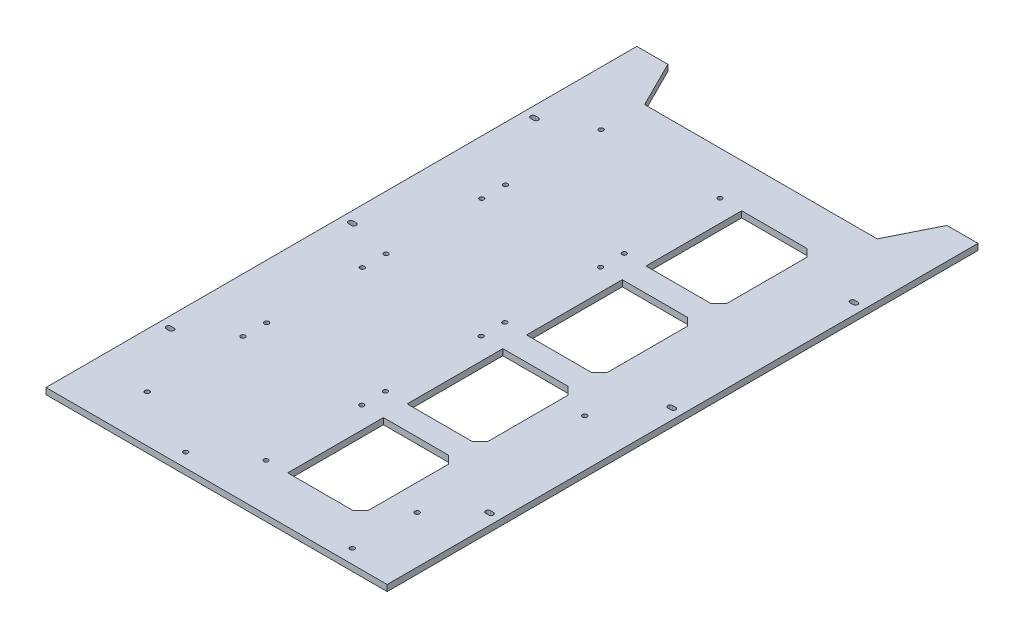
from build123d import *

# Parameters (mm, degrees)
SKETCH_1_W              = 220
SKETCH_1_H              = 381
EXTRUDE_1_DEPTH         = 4
CUT_EXTRUDE_2_DEPTH     = 221.014204087
HOLE_WIZARD_2_9_2_9_1_D = 2.9
F_3_0MM_1_D             = 3
F_3_0MM_2_D             = 3
CUT_EXTRUDE_3_DEPTH     = 221.014204087
CUT_EXTRUDE_4_DEPTH     = 221.014204087


with BuildPart() as part:
    # 草圖1 → 填料-伸長1 (new body)
    with BuildSketch(Plane(origin=(0, 0, 0), x_dir=(1, 0, 0), z_dir=(0, 1, 0))):
        Rectangle(SKETCH_1_W, SKETCH_1_H)
    extrude(amount=EXTRUDE_1_DEPTH)

    # 草圖2 → 除料-伸長2 (cut, through all)
    with BuildSketch(Plane(origin=(0, 4, 0), x_dir=(1, 0, 0), z_dir=(0, 1, 0))):
        Polygon((57.6, 132.5), (62.6, 127.5), (62.6, 75.78), (57.6, 70.78), (15.6, 70.78), (15.6, 132.5), align=None)
        Polygon((15.6, 55.5), (15.6, -6.22), (57.6, -6.22), (62.6, -1.22), (62.6, 50.5), (57.6, 55.5), align=None)
        Polygon((15.6, -21.5), (15.6, -83.22), (57.6, -83.22), (62.6, -78.22), (62.6, -26.5), (57.6, -21.5), align=None)
        Polygon((15.6, -98.5), (15.6, -160.22), (57.6, -160.22), (62.6, -155.22), (62.6, -103.5), (57.6, -98.5), align=None)
    extrude(amount=-CUT_EXTRUDE_2_DEPTH, mode=Mode.SUBTRACT)

    # Ø2.9 (2.9) 直徑孔1 (through all)
    with Locations(Plane(origin=(-75, 4, -132.5), x_dir=(0, 0, 1), z_dir=(0, 1, 0))):
        with Locations((0, 0), (0, 76.6), (61.72, 0), (61.72, 76.6), (77, 76.6), (77, 0), (138.72, 0), (138.72, 76.6), (154, 0), (154, 76.6), (215.72, 0), (215.72, 76.6), (231, 76.6), (231, 0), (292.72, 0), (292.72, 76.6), (314, 46.14), (314, 153.5)):
            Hole(HOLE_WIZARD_2_9_2_9_1_D / 2)

    # Ø3.0mm 定位孔1 (through all)
    with Locations(Plane(origin=(79.5, 4, 32.625), x_dir=(0, 0, 1), z_dir=(0, 1, 0))):
        with Locations((0, 0), (108, 0)):
            Hole(F_3_0MM_1_D / 2)

    # Ø3.0mm 定位孔2 (through all)
    with Locations(Plane(origin=(-103, 4, -117.5), x_dir=(0, 0, 1), z_dir=(0, 1, 0))):
        with Locations((0, 0), (0, 206), (117.5, 206), (117.5, 0), (235, 206), (235, 0)):
            Hole(F_3_0MM_2_D / 2)

    # 草圖12 → 除料-伸長3 (cut, through all)
    with BuildSketch(Plane(origin=(0, 4, 0), x_dir=(1, 0, 0), z_dir=(0, 1, 0))):
        Polygon((-90, 190.5), (90, 190.5), (75, 160.5), (-75, 160.5), align=None)
    extrude(amount=-CUT_EXTRUDE_3_DEPTH, mode=Mode.SUBTRACT)

    # 草圖14 → 除料-伸長4 (cut, through all)
    with BuildSketch(Plane(origin=(0, 4, 0), x_dir=(1, 0, 0), z_dir=(0, 1, 0))):
        with BuildLine():
            Line((-104, 119), (-102, 119))
            ThreePointArc((-102, 119), (-100.5, 117.5), (-102, 116))
            Line((-102, 116), (-104, 116))
            ThreePointArc((-104, 116), (-105.5, 117.5), (-104, 119))
        make_face()
        with BuildLine():
            Line((102, 119), (104, 119))
            ThreePointArc((104, 119), (105.5, 117.5), (104, 116))
            Line((104, 116), (102, 116))
            ThreePointArc((102, 116), (100.5, 117.5), (102, 119))
        make_face()
        with BuildLine():
            Line((102, 1.5), (104, 1.5))
            ThreePointArc((104, 1.5), (105.5, 0), (104, -1.5))
            Line((104, -1.5), (102, -1.5))
            ThreePointArc((102, -1.5), (100.5, 0), (102, 1.5))
        make_face()
        with BuildLine():
            Line((102, -116), (104, -116))
            ThreePointArc((104, -116), (105.5, -117.5), (104, -119))
            Line((104, -119), (102, -119))
            ThreePointArc((102, -119), (100.5, -117.5), (102, -116))
        make_face()
        with BuildLine():
            Line((-104, 1.5), (-102, 1.5))
            ThreePointArc((-102, 1.5), (-100.5, 0), (-102, -1.5))
            Line((-102, -1.5), (-104, -1.5))
            ThreePointArc((-104, -1.5), (-105.5, 0), (-104, 1.5))
        make_face()
        with BuildLine():
            Line((-104, -116), (-102, -116))
            ThreePointArc((-102, -116), (-100.5, -117.5), (-102, -119))
            Line((-102, -119), (-104, -119))
            ThreePointArc((-104, -119), (-105.5, -117.5), (-104, -116))
        make_face()
    extrude(amount=-CUT_EXTRUDE_4_DEPTH, mode=Mode.SUBTRACT)


solid = part.part
